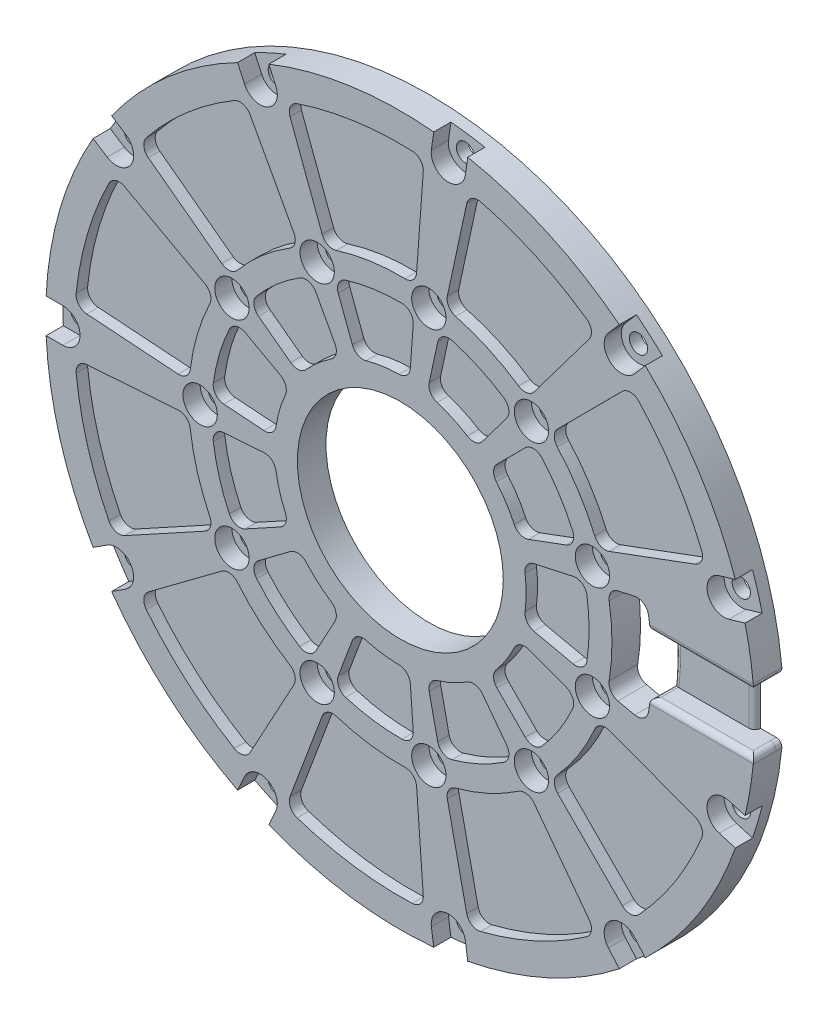
from build123d import *

# Parameters (mm, degrees)
SKETCH1_R           = 62
SKETCH1_R_2         = 18
BOSS_EXTRUDE1_DEPTH = 5
SKETCH2_R           = 1.575
CUT_EXTRUDE1_DEPTH  = 187.508589815
SKETCH4_R           = 1.6
CUT_EXTRUDE3_DEPTH  = 187.508589815
CUT_EXTRUDE2_DEPTH  = 2
CUT_EXTRUDE5_DEPTH  = 187.508589815
CUT_EXTRUDE6_DEPTH  = 4
FILLET1_R           = 1
SKETCH8_W           = 8
SKETCH8_H           = 10
CUT_EXTRUDE7_DEPTH  = 187.484460681
FILLET2_R           = 1
FILLET3_R           = 1
SKETCH10_R          = 3
CUT_EXTRUDE8_DEPTH  = 3


with BuildPart() as part:
    # Sketch1 → Boss-Extrude1 (new body)
    with BuildSketch(Plane.XY.offset(-63.995840519)):
        with Locations((89.072792821, 47.25870832)):
            Circle(SKETCH1_R)
        with Locations((89.072792821, 47.25870832)):
            Circle(SKETCH1_R_2, mode=Mode.SUBTRACT)
    extrude(amount=BOSS_EXTRUDE1_DEPTH)

    # Sketch2 → Cut-Extrude1 (cut, through all)
    with BuildSketch(Plane.XY.offset(-58.995840519)):
        with Locations((54.072792821, 47.25870832)):
            Circle(SKETCH2_R)
        with Locations((59.628919172, 66.181136931)):
            Circle(SKETCH2_R)
        with Locations((74.533267366, 79.095828158)):
            Circle(SKETCH2_R)
        with Locations((94.053812161, 81.902458786)):
            Circle(SKETCH2_R)
        with Locations((111.992918509, 73.709943423)):
            Circle(SKETCH2_R)
        with Locations((122.655046898, 57.11934781)):
            Circle(SKETCH2_R)
        with Locations((122.655046898, 37.398068831)):
            Circle(SKETCH2_R)
        with Locations((111.992918509, 20.807473218)):
            Circle(SKETCH2_R)
        with Locations((94.053812161, 12.614957855)):
            Circle(SKETCH2_R)
        with Locations((74.533267366, 15.421588483)):
            Circle(SKETCH2_R)
        with Locations((59.628919172, 28.33627971)):
            Circle(SKETCH2_R)
    extrude(amount=-CUT_EXTRUDE1_DEPTH, mode=Mode.SUBTRACT)

    # Sketch4 → Cut-Extrude3 (cut, through all)
    with BuildSketch(Plane.XY.offset(-58.995840519)):
        with Locations((30.072792821, 47.25870832)):
            Circle(SKETCH4_R)
        with Locations((39.438834384, 79.15651655)):
            Circle(SKETCH4_R)
        with Locations((64.563307054, 100.926996046)):
            Circle(SKETCH4_R)
        with Locations((97.469368279, 105.658173391)):
            Circle(SKETCH4_R)
        with Locations((127.709576124, 91.847933207)):
            Circle(SKETCH4_R)
        with Locations((145.682878264, 63.880929174)):
            Circle(SKETCH4_R)
        with Locations((145.682878264, 30.636487467)):
            Circle(SKETCH4_R)
        with Locations((127.709576124, 2.669483434)):
            Circle(SKETCH4_R)
        with Locations((97.469368279, -11.14075675)):
            Circle(SKETCH4_R)
        with Locations((64.563307054, -6.409579405)):
            Circle(SKETCH4_R)
        with Locations((39.438834384, 15.360900091)):
            Circle(SKETCH4_R)
    extrude(amount=-CUT_EXTRUDE3_DEPTH, mode=Mode.SUBTRACT)

    # Sketch3 → Cut-Extrude2 (cut)
    with BuildSketch(Plane.XY.offset(-58.995840519)):
        with BuildLine():
            Line((78.215997152, 76.226448788), (80.679280936, 69.653997071))
            ThreePointArc((80.679280936, 69.653997071), (81.648923359, 68.571429294), (83.09546271, 68.431132007))
            ThreePointArc((83.09546271, 68.431132007), (85.941866379, 69.034780042), (88.843038004, 69.257508577))
            ThreePointArc((88.843038004, 69.257508577), (90.191456034, 69.799660068), (90.816826538, 71.111556083))
            Line((90.816826538, 71.111556083), (91.328656394, 78.111764564))
            ThreePointArc((91.328656394, 78.111764564), (90.804574217, 79.613098956), (89.350831912, 80.257537001))
            ThreePointArc((89.350831912, 80.257537001), (84.376403158, 79.922815903), (79.50917189, 78.842519913))
            ThreePointArc((79.50917189, 78.842519913), (78.295875541, 77.8146196), (78.215997152, 76.226448788))
        make_face()
        with BuildLine():
            Line((75.403737986, 83.730024994), (69.783288936, 98.726319882))
            ThreePointArc((69.783288936, 98.726319882), (69.850854152, 100.289133051), (71.022741946, 101.325293781))
            ThreePointArc((71.022741946, 101.325293781), (80.96084704, 103.678530508), (91.159372448, 104.220504162))
            ThreePointArc((91.159372448, 104.220504162), (92.575710764, 103.556474166), (93.080834464, 102.076001232))
            Line((93.080834464, 102.076001232), (91.912997594, 86.103698176))
            ThreePointArc((91.912997594, 86.103698176), (91.264036124, 84.769996337), (89.874961774, 84.25001169))
            ThreePointArc((89.874961774, 84.25001169), (83.807143805, 83.88210167), (77.881462868, 82.525606878))
            ThreePointArc((77.881462868, 82.525606878), (76.402159185, 82.633181025), (75.403737986, 83.730024994))
        make_face()
        with BuildLine():
            Line((127.118193407, 55.598222352), (130.052203138, 56.241354372))
            ThreePointArc((130.052203138, 56.241354372), (131.598850611, 55.945791996), (132.452226422, 54.622453321))
            ThreePointArc((132.452226422, 54.622453321), (133.072792821, 47.25870832), (132.452226422, 39.89496332))
            ThreePointArc((132.452226422, 39.89496332), (131.598850611, 38.571624645), (130.052203138, 38.276062269))
            Line((130.052203138, 38.276062269), (127.118193407, 38.919194289))
            ThreePointArc((127.118193407, 38.919194289), (125.890423576, 39.751355828), (125.573417515, 41.200292935))
            ThreePointArc((125.573417515, 41.200292935), (126.072792821, 47.25870832), (125.573417515, 53.317123706))
            ThreePointArc((125.573417515, 53.317123706), (125.890423576, 54.766060813), (127.118193407, 55.598222352))
        make_face()
        with BuildLine():
            Line((122.081038063, 91.207038733), (112.463312189, 78.401662639))
            ThreePointArc((112.463312189, 78.401662639), (111.196317408, 77.630536315), (109.746628779, 77.944087686))
            ThreePointArc((109.746628779, 77.944087686), (104.443148302, 80.915092149), (98.724771827, 82.977601098))
            ThreePointArc((98.724771827, 82.977601098), (97.538461352, 83.867870182), (97.291534611, 85.330381299))
            Line((97.291534611, 85.330381299), (100.670921119, 100.984711522))
            ThreePointArc((100.670921119, 100.984711522), (101.572681184, 102.262905108), (103.118726715, 102.501008608))
            ThreePointArc((103.118726715, 102.501008608), (112.751448562, 99.107732056), (121.624007171, 94.049930193))
            ThreePointArc((121.624007171, 94.049930193), (122.456505064, 92.725582309), (122.081038063, 91.207038733))
        make_face()
        with BuildLine():
            Line((140.601357024, 66.384791852), (125.587302155, 60.811959152))
            ThreePointArc((125.587302155, 60.811959152), (124.104535953, 60.848235502), (123.054498942, 61.895772546))
            ThreePointArc((123.054498942, 61.895772546), (120.199173536, 67.262418566), (116.503645648, 72.089099239))
            ThreePointArc((116.503645648, 72.089099239), (115.986973576, 73.479409116), (116.569938788, 74.843250435))
            Line((116.569938788, 74.843250435), (127.876229515, 86.185476755))
            ThreePointArc((127.876229515, 86.185476755), (129.325881981, 86.773233326), (130.755226717, 86.137683417))
            ThreePointArc((130.755226717, 86.137683417), (137.024244193, 78.075234915), (141.753861334, 69.023473891))
            ThreePointArc((141.753861334, 69.023473891), (141.738206604, 67.459279214), (140.601357024, 66.384791852))
        make_face()
        with BuildLine():
            Line((127.876229515, 8.331939886), (116.569938788, 19.674166206))
            ThreePointArc((116.569938788, 19.674166206), (115.986973576, 21.038007525), (116.503645648, 22.428317402))
            ThreePointArc((116.503645648, 22.428317402), (120.199173536, 27.254998075), (123.054498942, 32.621644095))
            ThreePointArc((123.054498942, 32.621644095), (124.104535953, 33.669181139), (125.587302155, 33.705457489))
            Line((125.587302155, 33.705457489), (140.601357024, 28.132624789))
            ThreePointArc((140.601357024, 28.132624789), (141.738206604, 27.058137428), (141.753861334, 25.49394275))
            ThreePointArc((141.753861334, 25.49394275), (137.024244193, 16.442181726), (130.755226717, 8.379733224))
            ThreePointArc((130.755226717, 8.379733224), (129.325881981, 7.744183315), (127.876229515, 8.331939886))
        make_face()
        with BuildLine():
            Line((100.670921119, -6.467294881), (97.291534611, 9.187035342))
            ThreePointArc((97.291534611, 9.187035342), (97.538461352, 10.649546459), (98.724771827, 11.539815543))
            ThreePointArc((98.724771827, 11.539815543), (104.443148302, 13.602324492), (109.746628779, 16.573328955))
            ThreePointArc((109.746628779, 16.573328955), (111.196317408, 16.886880326), (112.463312189, 16.115754002))
            Line((112.463312189, 16.115754002), (122.081038063, 3.310377908))
            ThreePointArc((122.081038063, 3.310377908), (122.456505064, 1.791834332), (121.624007171, 0.467486448))
            ThreePointArc((121.624007171, 0.467486448), (112.751448562, -4.590315415), (103.118726715, -7.983591967))
            ThreePointArc((103.118726715, -7.983591967), (101.572681184, -7.745488467), (100.670921119, -6.467294881))
        make_face()
        with BuildLine():
            Line((69.783288936, -4.208903241), (75.403737986, 10.787391647))
            ThreePointArc((75.403737986, 10.787391647), (76.402159185, 11.884235616), (77.881462868, 11.991809763))
            ThreePointArc((77.881462868, 11.991809763), (83.807143805, 10.635314971), (89.874961774, 10.267404951))
            ThreePointArc((89.874961774, 10.267404951), (91.264036124, 9.747420304), (91.912997594, 8.413718465))
            Line((91.912997594, 8.413718465), (93.080834464, -7.558584591))
            ThreePointArc((93.080834464, -7.558584591), (92.575710764, -9.039057525), (91.159372448, -9.703087521))
            ThreePointArc((91.159372448, -9.703087521), (80.96084704, -9.161113867), (71.022741946, -6.80787714))
            ThreePointArc((71.022741946, -6.80787714), (69.850854152, -5.77171641), (69.783288936, -4.208903241))
        make_face()
        with BuildLine():
            Line((45.019937944, 14.390091416), (57.855769691, 23.967133302))
            ThreePointArc((57.855769691, 23.967133302), (59.288693672, 24.350069912), (60.591322096, 23.640795091))
            ThreePointArc((60.591322096, 23.640795091), (64.842945665, 19.295974069), (69.748611794, 15.705958399))
            ThreePointArc((69.748611794, 15.705958399), (70.636050574, 14.517529185), (70.460938051, 13.044692742))
            Line((70.460938051, 13.044692742), (62.808105962, -1.023443912))
            ThreePointArc((62.808105962, -1.023443912), (61.582764768, -1.995806508), (60.032263436, -1.788693783))
            ThreePointArc((60.032263436, -1.788693783), (51.745730986, 4.180982582), (44.657520794, 11.533596554))
            ThreePointArc((44.657520794, 11.533596554), (44.231856831, 13.038840803), (45.019937944, 14.390091416))
        make_face()
        with BuildLine():
            Line((34.243057113, 43.424639703), (50.21898567, 44.541785455))
            ThreePointArc((50.21898567, 44.541785455), (51.631469194, 44.089235038), (52.343847038, 42.788300993))
            ThreePointArc((52.343847038, 42.788300993), (53.571552797, 36.834603717), (55.757552752, 31.162287005))
            ThreePointArc((55.757552752, 31.162287005), (55.861600419, 29.682731104), (54.918010892, 28.53837522))
            Line((54.918010892, 28.53837522), (40.874229961, 20.840938956))
            ThreePointArc((40.874229961, 20.840938956), (39.317708444, 20.685404952), (38.125317314, 21.697903571))
            ThreePointArc((38.125317314, 21.697903571), (34.381693325, 31.199952581), (32.393834687, 41.217540812))
            ThreePointArc((32.393834687, 41.217540812), (32.849539856, 42.713964168), (34.243057113, 43.424639703))
        make_face()
        with BuildLine():
            Line((40.874229961, 73.676477685), (54.918010892, 65.979041421))
            ThreePointArc((54.918010892, 65.979041421), (55.861600419, 64.834685537), (55.757552752, 63.355129636))
            ThreePointArc((55.757552752, 63.355129636), (53.571552797, 57.682812924), (52.343847038, 51.729115648))
            ThreePointArc((52.343847038, 51.729115648), (51.631469194, 50.428181603), (50.21898567, 49.975631186))
            Line((50.21898567, 49.975631186), (34.243057113, 51.092776938))
            ThreePointArc((34.243057113, 51.092776938), (32.849539856, 51.803452473), (32.393834687, 53.299875829))
            ThreePointArc((32.393834687, 53.299875829), (34.381693325, 63.31746406), (38.125317314, 72.81951307))
            ThreePointArc((38.125317314, 72.81951307), (39.317708444, 73.832011689), (40.874229961, 73.676477685))
        make_face()
        with BuildLine():
            Line((62.808105962, 95.540860553), (70.460938051, 81.472723899))
            ThreePointArc((70.460938051, 81.472723899), (70.636050574, 79.999887456), (69.748611794, 78.811458242))
            ThreePointArc((69.748611794, 78.811458242), (64.842945665, 75.221442572), (60.591322096, 70.87662155))
            ThreePointArc((60.591322096, 70.87662155), (59.288693672, 70.167346729), (57.855769691, 70.550283339))
            Line((57.855769691, 70.550283339), (45.019937944, 80.127325224))
            ThreePointArc((45.019937944, 80.127325224), (44.231856831, 81.478575838), (44.657520794, 82.983820087))
            ThreePointArc((44.657520794, 82.983820087), (51.745730986, 90.336434059), (60.032263436, 96.306110423))
            ThreePointArc((60.032263436, 96.306110423), (61.582764768, 96.513223149), (62.808105962, 95.540860553))
        make_face()
        with BuildLine():
            Line((95.600617996, 77.497549212), (94.119528512, 70.636699228))
            ThreePointArc((94.119528512, 70.636699228), (94.349963298, 69.201756988), (95.491019197, 68.301673182))
            ThreePointArc((95.491019197, 68.301673182), (98.211923107, 67.270612218), (100.772960123, 65.889491586))
            ThreePointArc((100.772960123, 65.889491586), (102.20043078, 65.616568618), (103.43579046, 66.382104954))
            Line((103.43579046, 66.382104954), (107.650967569, 71.994338958))
            ThreePointArc((107.650967569, 71.994338958), (108.02176424, 73.540682035), (107.147207901, 74.868770246))
            ThreePointArc((107.147207901, 74.868770246), (102.78148825, 77.276564167), (98.102860644, 78.999185241))
            ThreePointArc((98.102860644, 78.999185241), (96.526445938, 78.790418001), (95.600617996, 77.497549212))
        make_face()
        with BuildLine():
            Line((110.91270047, 69.168031311), (105.957473165, 64.197054453))
            ThreePointArc((105.957473165, 64.197054453), (105.375538897, 62.865321773), (105.848834159, 61.491221697))
            ThreePointArc((105.848834159, 61.491221697), (107.580370543, 59.152806304), (108.988161794, 56.606332548))
            ThreePointArc((108.988161794, 56.606332548), (110.04147323, 55.604986233), (111.494604116, 55.581110514))
            Line((111.494604116, 55.581110514), (118.07483953, 58.023525398))
            ThreePointArc((118.07483953, 58.023525398), (119.222789725, 59.12392416), (119.20508481, 60.714003913))
            ThreePointArc((119.20508481, 60.714003913), (116.834159405, 65.099855297), (113.829566667, 69.078473414))
            ThreePointArc((113.829566667, 69.078473414), (112.390534136, 69.755121371), (110.91270047, 69.168031311))
        make_face()
        with BuildLine():
            Line((119.290766579, 53.882458164), (112.43465111, 52.379604461))
            ThreePointArc((112.43465111, 52.379604461), (111.225107807, 51.573897057), (110.88037453, 50.162047777))
            ThreePointArc((110.88037453, 50.162047777), (111.072792821, 47.25870832), (110.88037453, 44.355368864))
            ThreePointArc((110.88037453, 44.355368864), (111.225107807, 42.943519584), (112.43465111, 42.13781218))
            Line((112.43465111, 42.13781218), (119.290766579, 40.634958477))
            ThreePointArc((119.290766579, 40.634958477), (120.851404222, 40.940044091), (121.696171918, 42.2872763))
            ThreePointArc((121.696171918, 42.2872763), (122.072792821, 47.25870832), (121.696171918, 52.230140341))
            ThreePointArc((121.696171918, 52.230140341), (120.851404222, 53.57737255), (119.290766579, 53.882458164))
        make_face()
        with BuildLine():
            Line((118.07483953, 36.493891243), (111.494604116, 38.936306127))
            ThreePointArc((111.494604116, 38.936306127), (110.04147323, 38.912430408), (108.988161794, 37.911084093))
            ThreePointArc((108.988161794, 37.911084093), (107.580370543, 35.364610336), (105.848834159, 33.026194944))
            ThreePointArc((105.848834159, 33.026194944), (105.375538897, 31.652094868), (105.957473165, 30.320362188))
            Line((105.957473165, 30.320362188), (110.91270047, 25.34938533))
            ThreePointArc((110.91270047, 25.34938533), (112.390534136, 24.76229527), (113.829566667, 25.438943227))
            ThreePointArc((113.829566667, 25.438943227), (116.834159405, 29.417561344), (119.20508481, 33.803412728))
            ThreePointArc((119.20508481, 33.803412728), (119.222789725, 35.393492481), (118.07483953, 36.493891243))
        make_face()
        with BuildLine():
            Line((107.650967569, 22.523077683), (103.43579046, 28.135311687))
            ThreePointArc((103.43579046, 28.135311687), (102.20043078, 28.900848023), (100.772960123, 28.627925055))
            ThreePointArc((100.772960123, 28.627925055), (98.211923107, 27.246804423), (95.491019197, 26.215743458))
            ThreePointArc((95.491019197, 26.215743458), (94.349963298, 25.315659653), (94.119528512, 23.880717413))
            Line((94.119528512, 23.880717413), (95.600617996, 17.019867429))
            ThreePointArc((95.600617996, 17.019867429), (96.526445938, 15.72699864), (98.102860644, 15.5182314))
            ThreePointArc((98.102860644, 15.5182314), (102.78148825, 17.240852474), (107.147207901, 19.648646395))
            ThreePointArc((107.147207901, 19.648646395), (108.02176424, 20.976734606), (107.650967569, 22.523077683))
        make_face()
        with BuildLine():
            Line((91.328656394, 16.405652077), (90.816826538, 23.405860558))
            ThreePointArc((90.816826538, 23.405860558), (90.191456034, 24.717756573), (88.843038004, 25.259908064))
            ThreePointArc((88.843038004, 25.259908064), (85.941866379, 25.482636599), (83.09546271, 26.086284634))
            ThreePointArc((83.09546271, 26.086284634), (81.648923359, 25.945987347), (80.679280936, 24.86341957))
            Line((80.679280936, 24.86341957), (78.215997152, 18.290967853))
            ThreePointArc((78.215997152, 18.290967853), (78.295875541, 16.702797041), (79.50917189, 15.674896728))
            ThreePointArc((79.50917189, 15.674896728), (84.376403158, 14.594600738), (89.350831912, 14.25987964))
            ThreePointArc((89.350831912, 14.25987964), (90.804574217, 14.904317685), (91.328656394, 16.405652077))
        make_face()
        with BuildLine():
            Line((74.290124473, 20.083853831), (77.644144234, 26.249520057))
            ThreePointArc((77.644144234, 26.249520057), (77.827313622, 27.691258036), (76.986061416, 28.876354719))
            ThreePointArc((76.986061416, 28.876354719), (74.665856674, 30.632217685), (72.597666299, 32.678920733))
            ThreePointArc((72.597666299, 32.678920733), (71.30490952, 33.342953362), (69.903914077, 32.956467667))
            Line((69.903914077, 32.956467667), (64.278332223, 28.759121199))
            ThreePointArc((64.278332223, 28.759121199), (63.486900234, 27.379881376), (63.951865209, 25.859199076))
            ThreePointArc((63.951865209, 25.859199076), (67.462388601, 22.318972367), (71.466180476, 19.348007833))
            ThreePointArc((71.466180476, 19.348007833), (73.037555837, 19.104191186), (74.290124473, 20.083853831))
        make_face()
        with BuildLine():
            Line((61.944985303, 32.389879877), (68.099977105, 35.763448387))
            ThreePointArc((68.099977105, 35.763448387), (69.033531399, 36.877286707), (68.966536648, 38.329068759))
            ThreePointArc((68.966536648, 38.329068759), (67.963947402, 41.06059207), (67.330606151, 43.900536376))
            ThreePointArc((67.330606151, 43.900536376), (66.602073087, 45.158073252), (65.214530779, 45.590376117))
            Line((65.214530779, 45.590376117), (58.212733345, 45.100762745))
            ThreePointArc((58.212733345, 45.100762745), (56.801265042, 44.368352808), (56.370275548, 42.837694407))
            ThreePointArc((56.370275548, 42.837694407), (57.409524692, 37.961533945), (59.171504057, 33.297586222))
            ThreePointArc((59.171504057, 33.297586222), (60.3616119, 32.242924947), (61.944985303, 32.389879877))
        make_face()
        with BuildLine():
            Line((58.212733345, 49.416653896), (65.214530779, 48.927040524))
            ThreePointArc((65.214530779, 48.927040524), (66.602073087, 49.359343389), (67.330606151, 50.616880265))
            ThreePointArc((67.330606151, 50.616880265), (67.963947402, 53.456824571), (68.966536648, 56.188347882))
            ThreePointArc((68.966536648, 56.188347882), (69.033531399, 57.640129934), (68.099977105, 58.753968254))
            Line((68.099977105, 58.753968254), (61.944985303, 62.127536764))
            ThreePointArc((61.944985303, 62.127536764), (60.3616119, 62.274491694), (59.171504057, 61.219830419))
            ThreePointArc((59.171504057, 61.219830419), (57.409524692, 56.555882696), (56.370275548, 51.679722234))
            ThreePointArc((56.370275548, 51.679722234), (56.801265042, 50.149063833), (58.212733345, 49.416653896))
        make_face()
        with BuildLine():
            Line((64.278332223, 65.758295442), (69.903914077, 61.560948974))
            ThreePointArc((69.903914077, 61.560948974), (71.30490952, 61.174463279), (72.597666299, 61.838495908))
            ThreePointArc((72.597666299, 61.838495908), (74.665856674, 63.885198956), (76.986061416, 65.641061922))
            ThreePointArc((76.986061416, 65.641061922), (77.827313622, 66.826158605), (77.644144234, 68.267896584))
            Line((77.644144234, 68.267896584), (74.290124473, 74.43356281))
            ThreePointArc((74.290124473, 74.43356281), (73.037555838, 75.413225455), (71.466180476, 75.169408808))
            ThreePointArc((71.466180476, 75.169408808), (67.462388601, 72.198444274), (63.951865209, 68.658217565))
            ThreePointArc((63.951865209, 68.658217565), (63.486900234, 67.137535265), (64.278332223, 65.758295442))
        make_face()
    extrude(amount=-CUT_EXTRUDE2_DEPTH, mode=Mode.SUBTRACT)

    # Sketch3<3> → Cut-Extrude5 (cut, through all)
    with BuildSketch(Plane.XY.offset(-58.995840519)):
        with BuildLine():
            ThreePointArc((132.452226422, 39.89496332), (131.598850611, 38.571624645), (130.052203138, 38.276062269))
            Line((130.052203138, 38.276062269), (127.118193407, 38.919194289))
            ThreePointArc((127.118193407, 38.919194289), (125.890423576, 39.751355828), (125.573417515, 41.200292935))
            ThreePointArc((125.573417515, 41.200292935), (126.072792821, 47.25870832), (125.573417515, 53.317123706))
            ThreePointArc((125.573417515, 53.317123706), (125.890423576, 54.766060813), (127.118193407, 55.598222352))
            Line((127.118193407, 55.598222352), (130.052203138, 56.241354372))
            ThreePointArc((130.052203138, 56.241354372), (131.598850611, 55.945791996), (132.452226422, 54.622453321))
            ThreePointArc((132.452226422, 54.622453321), (133.072792821, 47.25870832), (132.452226422, 39.89496332))
        make_face()
    extrude(amount=-CUT_EXTRUDE5_DEPTH, mode=Mode.SUBTRACT)

    # Sketch7 → Cut-Extrude6 (cut)
    with BuildSketch(Plane.XY.offset(-58.995840519)):
        Polygon((132.78777881, 52.25870832), (151.072792821, 52.25870832), (151.072792821, 47.25870832), (151.072792821, 42.25870832), (132.78777881, 42.25870832), align=None)
    extrude(amount=-CUT_EXTRUDE6_DEPTH, mode=Mode.SUBTRACT)

    # Fillet1
    fillet1_edges = [part.edges().sort_by_distance(p)[0] for p in [
        (133.072792821, 47.25870832, -62.995840519),
        (150.870851043, 42.25870832, -60.995840519),
        (132.78777881, 52.25870832, -60.995840519),
        (141.829314927, 52.25870832, -58.995840519),
        (141.829314927, 42.25870832, -58.995840519),
        (132.78777881, 42.25870832, -60.995840519),
        (150.870851043, 52.25870832, -60.995840519),
    ]]
    fillet(fillet1_edges, radius=FILLET1_R - 0.0001)  # a hair under: the kernel refuses the full size

    # Sketch8 → Cut-Extrude7 (cut, through all)
    with BuildSketch(Plane.XY.offset(-62.995840519)):
        with Locations((151.072792821, 47.25870832)):
            Rectangle(SKETCH8_W, SKETCH8_H)
    extrude(amount=-CUT_EXTRUDE7_DEPTH, mode=Mode.SUBTRACT)

    # Fillet2
    fillet2_edges = [part.edges().sort_by_distance(p)[0] for p in [
        (150.870851043, 42.25870832, -63.495840519),
        (150.870851043, 52.25870832, -63.495840519),
    ]]
    fillet(fillet2_edges, radius=FILLET2_R - 0.0001)  # a hair under: the kernel refuses the full size

    # Fillet3
    fillet3_edges = [part.edges().sort_by_distance(p)[0] for p in [
        (147.072792821, 47.25870832, -62.995840519),
    ]]
    fillet(fillet3_edges, radius=FILLET3_R - 0.0001)  # a hair under: the kernel refuses the full size

    # Sketch10 → Cut-Extrude8 (cut)
    with BuildSketch(Plane.XY.offset(-58.995840519)):
        with Locations((54.072792821, 47.25870832)):
            Circle(SKETCH10_R)
        with Locations((59.628919172, 66.181136931)):
            Circle(SKETCH10_R)
        with Locations((74.533267366, 79.095828158)):
            Circle(SKETCH10_R)
        with Locations((94.053812161, 81.902458786)):
            Circle(SKETCH10_R)
        with Locations((111.992918509, 73.709943423)):
            Circle(SKETCH10_R)
        with Locations((122.655046898, 57.11934781)):
            Circle(SKETCH10_R)
        with Locations((122.655046898, 37.398068831)):
            Circle(SKETCH10_R)
        with Locations((111.992918509, 20.807473218)):
            Circle(SKETCH10_R)
        with Locations((94.053812161, 12.614957855)):
            Circle(SKETCH10_R)
        with Locations((74.533267366, 15.421588483)):
            Circle(SKETCH10_R)
        with Locations((59.628919172, 28.33627971)):
            Circle(SKETCH10_R)
        with BuildLine():
            Line((30.072792821, 44.25870832), (27.256230484, 44.25870832))
            Line((27.256230484, 44.25870832), (26.296230945, 44.25870832))
            Line((26.296230945, 44.25870832), (26.296230945, 50.25870832))
            Line((26.296230945, 50.25870832), (27.256230484, 50.25870832))
            Line((27.256230484, 50.25870832), (30.072792821, 50.25870832))
            ThreePointArc((30.072792821, 50.25870832), (33.072792821, 47.25870832), (30.072792821, 44.25870832))
        make_face()
        with BuildLine():
            Line((37.883710817, 83.722040649), (34.639865912, 78.674519452))
            Line((34.639865912, 78.674519452), (35.447468915, 78.155504516))
            Line((35.447468915, 78.155504516), (37.816911932, 76.632755952))
            ThreePointArc((37.816911932, 76.632755952), (41.962594983, 77.534594098), (41.060756837, 81.680277149))
            Line((41.060756837, 81.680277149), (38.69131382, 83.203025713))
            Line((38.69131382, 83.203025713), (37.883710817, 83.722040649))
        make_face()
        with BuildLine():
            Line((65.723362539, 105.6085226), (60.265570567, 103.116032522))
            Line((60.265570567, 103.116032522), (60.664368788, 102.242786226))
            Line((60.664368788, 102.242786226), (61.834411068, 99.680751007))
            ThreePointArc((61.834411068, 99.680751007), (65.809552093, 98.19810006), (67.29220304, 102.173241085))
            Line((67.29220304, 102.173241085), (66.12216076, 104.735276304))
            Line((66.12216076, 104.735276304), (65.723362539, 105.6085226))
        make_face()
        with BuildLine():
            Line((100.976293398, 108.969350798), (95.037364746, 109.823239827))
            Line((95.037364746, 109.823239827), (94.900742567, 108.8730117))
            Line((94.900742567, 108.8730117), (94.499903954, 106.085117906))
            ThreePointArc((94.499903954, 106.085117906), (97.042423764, 102.688709066), (100.438832605, 105.231228877))
            Line((100.438832605, 105.231228877), (100.839671218, 108.019122671))
            Line((100.839671218, 108.019122671), (100.976293398, 108.969350798))
        make_face()
        with BuildLine():
            Line((132.449946929, 92.737486036), (127.915449483, 96.666650439))
            Line((127.915449483, 96.666650439), (127.28678348, 95.941131197))
            Line((127.28678348, 95.941131197), (125.442327401, 93.812515409))
            ThreePointArc((125.442327401, 93.812515409), (125.744993922, 89.580684484), (129.976824847, 89.883351006))
            Line((129.976824847, 89.883351006), (131.821280927, 92.011966793))
            Line((131.821280927, 92.011966793), (132.449946929, 92.737486036))
        make_face()
        with BuildLine():
            Line((150.151660519, 62.066430687), (148.461265178, 67.823388528))
            Line((148.461265178, 67.823388528), (147.540152366, 67.552925404))
            Line((147.540152366, 67.552925404), (144.837680594, 66.759408095))
            ThreePointArc((144.837680594, 66.759408095), (142.804399344, 63.035731504), (146.528075935, 61.002450253))
            Line((146.528075935, 61.002450253), (149.230547707, 61.795967562))
            Line((149.230547707, 61.795967562), (150.151660519, 62.066430687))
        make_face()
        with BuildLine():
            Line((148.461265178, 26.694028113), (150.151660519, 32.450985954))
            Line((150.151660519, 32.450985954), (149.230547707, 32.721449079))
            Line((149.230547707, 32.721449079), (146.528075935, 33.514966388))
            ThreePointArc((146.528075935, 33.514966388), (142.804399344, 31.481685137), (144.837680594, 27.758008546))
            Line((144.837680594, 27.758008546), (147.540152366, 26.964491237))
            Line((147.540152366, 26.964491237), (148.461265178, 26.694028113))
        make_face()
        with BuildLine():
            Line((127.915449483, -2.149233798), (132.449946929, 1.779930605))
            Line((132.449946929, 1.779930605), (131.821280927, 2.505449848))
            Line((131.821280927, 2.505449848), (129.976824847, 4.634065635))
            ThreePointArc((129.976824847, 4.634065635), (125.744993922, 4.936732157), (125.442327401, 0.704901232))
            Line((125.442327401, 0.704901232), (127.28678348, -1.423714556))
            Line((127.28678348, -1.423714556), (127.915449483, -2.149233798))
        make_face()
        with BuildLine():
            Line((95.037364746, -15.305823186), (100.976293398, -14.451934157))
            Line((100.976293398, -14.451934157), (100.839671218, -13.50170603))
            Line((100.839671218, -13.50170603), (100.438832605, -10.713812236))
            ThreePointArc((100.438832605, -10.713812236), (97.042423764, -8.171292425), (94.499903954, -11.567701265))
            Line((94.499903954, -11.567701265), (94.900742567, -14.355595059))
            Line((94.900742567, -14.355595059), (95.037364746, -15.305823186))
        make_face()
        with BuildLine():
            Line((60.265570567, -8.598615881), (65.723362539, -11.091105959))
            Line((65.723362539, -11.091105959), (66.12216076, -10.217859663))
            Line((66.12216076, -10.217859663), (67.29220304, -7.655824444))
            ThreePointArc((67.29220304, -7.655824444), (65.809552093, -3.680683419), (61.834411068, -5.163334366))
            Line((61.834411068, -5.163334366), (60.664368788, -7.725369585))
            Line((60.664368788, -7.725369585), (60.265570567, -8.598615881))
        make_face()
        with BuildLine():
            Line((34.639865912, 15.842897189), (37.883710817, 10.795375992))
            Line((37.883710817, 10.795375992), (38.69131382, 11.314390928))
            Line((38.69131382, 11.314390928), (41.060756837, 12.837139492))
            ThreePointArc((41.060756837, 12.837139492), (41.962594983, 16.982822543), (37.816911932, 17.884660689))
            Line((37.816911932, 17.884660689), (35.447468915, 16.361912125))
            Line((35.447468915, 16.361912125), (34.639865912, 15.842897189))
        make_face()
    extrude(amount=-CUT_EXTRUDE8_DEPTH, mode=Mode.SUBTRACT)


solid = part.part
